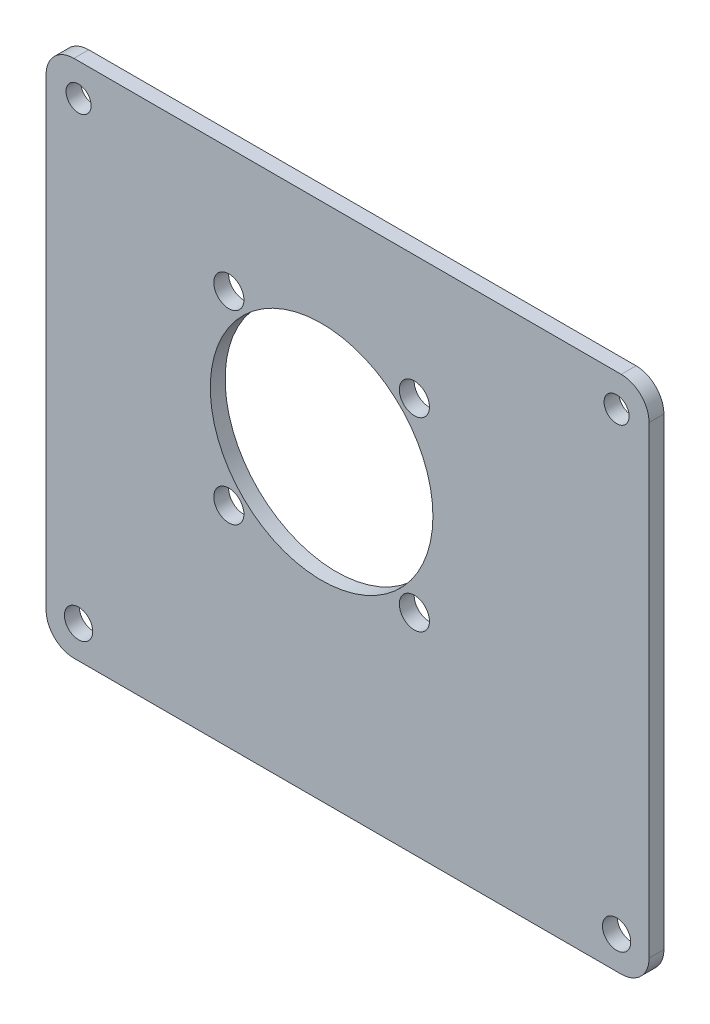
from build123d import *

# Parameters (mm, degrees)
SKETCH1_R           = 1.35
SKETCH1_R_2         = 1.524
BOSS_EXTRUDE1_DEPTH = 1.6
SKETCH2_R           = 1.625
SKETCH2_R_2         = 12
CUT_EXTRUDE1_DEPTH  = 51.919642575


with BuildPart() as part:
    # Sketch1 → Boss-Extrude1 (new body)
    with BuildSketch(Plane.XY):
        with BuildLine():
            Line((22.5, 25), (22.5, -25))
            ThreePointArc((22.5, -25), (21.621320344, -27.121320344), (19.5, -28))
            Line((19.5, -28), (-39.5, -28))
            ThreePointArc((-39.5, -28), (-41.621320344, -27.121320344), (-42.5, -25))
            Line((-42.5, -25), (-42.5, 25))
            ThreePointArc((-42.5, 25), (-41.621320344, 27.121320344), (-39.5, 28))
            Line((-39.5, 28), (19.5, 28))
            ThreePointArc((19.5, 28), (21.621320344, 27.121320344), (22.5, 25))
        make_face()
        with Locations((-39, 24.5)):
            Circle(SKETCH1_R, mode=Mode.SUBTRACT)
        with Locations((-39, -24.5)):
            Circle(SKETCH1_R_2, mode=Mode.SUBTRACT)
        with Locations((19, -24.5)):
            Circle(SKETCH1_R_2, mode=Mode.SUBTRACT)
        with Locations((19, 24.5)):
            Circle(SKETCH1_R, mode=Mode.SUBTRACT)
    extrude(amount=BOSS_EXTRUDE1_DEPTH)

    # Sketch2 → Cut-Extrude1 (cut, through all)
    with BuildSketch(Plane.XY.offset(1.6)):
        with Locations((-2.799944405, 14.60995525)):
            Circle(SKETCH2_R)
        with Locations((-22.799944405, 14.60995525)):
            Circle(SKETCH2_R)
        with Locations((-22.799944405, -5.39004475)):
            Circle(SKETCH2_R)
        with Locations((-2.799944405, -5.39004475)):
            Circle(SKETCH2_R)
        with Locations((-12.799944405, 4.60995525)):
            Circle(SKETCH2_R_2)
    extrude(amount=-CUT_EXTRUDE1_DEPTH, mode=Mode.SUBTRACT)


solid = part.part
